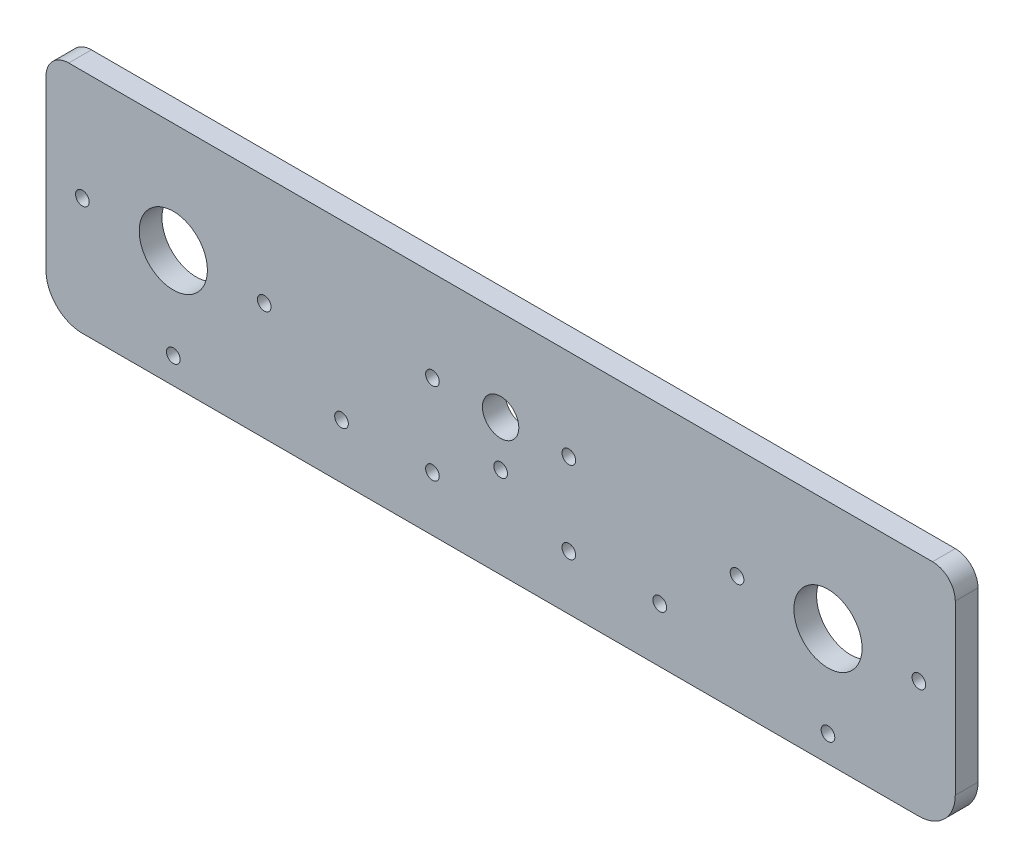
from build123d import *

# Parameters (mm, degrees)
CROQUIS1_R              = 1.5
CROQUIS1_R_2            = 7.5
CROQUIS1_R_3            = 4
SALIENTE_EXTRUIR1_DEPTH = 5
REDONDEO1_R             = 5


with BuildPart() as part:
    # Croquis1 → Saliente-Extruir1 (new body)
    with BuildSketch(Plane.XY):
        with BuildLine():
            Line((100, -37), (100, 0))
            Line((100, 0), (100, 5))
            Line((100, 5), (-100, 5))
            Line((-100, 5), (-100, 0))
            Line((-100, 0), (-100, -37))
            ThreePointArc((-100, -37), (-97.656854249, -42.656854249), (-92, -45))
            Line((-92, -45), (92, -45))
            ThreePointArc((92, -45), (97.656854249, -42.656854249), (100, -37))
        make_face()
        with Locations((-72, -39.25)):
            Circle(CROQUIS1_R, mode=Mode.SUBTRACT)
        with Locations((-35, -33)):
            Circle(CROQUIS1_R, mode=Mode.SUBTRACT)
        with Locations((-15, -33)):
            Circle(CROQUIS1_R, mode=Mode.SUBTRACT)
        with Locations((15, -33)):
            Circle(CROQUIS1_R, mode=Mode.SUBTRACT)
        with Locations((35, -33)):
            Circle(CROQUIS1_R, mode=Mode.SUBTRACT)
        with Locations((72, -39.25)):
            Circle(CROQUIS1_R, mode=Mode.SUBTRACT)
        with Locations((0, -25)):
            Circle(CROQUIS1_R, mode=Mode.SUBTRACT)
        with Locations((-92, -19.25)):
            Circle(CROQUIS1_R, mode=Mode.SUBTRACT)
        with Locations((-72, -19.25)):
            Circle(CROQUIS1_R_2, mode=Mode.SUBTRACT)
        with Locations((-52, -19.25)):
            Circle(CROQUIS1_R, mode=Mode.SUBTRACT)
        with Locations((-15, -15)):
            Circle(CROQUIS1_R, mode=Mode.SUBTRACT)
        with Locations((0, -15)):
            Circle(CROQUIS1_R_3, mode=Mode.SUBTRACT)
        with Locations((15, -15)):
            Circle(CROQUIS1_R, mode=Mode.SUBTRACT)
        with Locations((52, -19.25)):
            Circle(CROQUIS1_R, mode=Mode.SUBTRACT)
        with Locations((72, -19.25)):
            Circle(CROQUIS1_R_2, mode=Mode.SUBTRACT)
        with Locations((92, -19.25)):
            Circle(CROQUIS1_R, mode=Mode.SUBTRACT)
    extrude(amount=SALIENTE_EXTRUIR1_DEPTH)

    # Redondeo1
    redondeo1_edges = [part.edges().sort_by_distance(p)[0] for p in [
        (100, 5, 2.5),
        (-100, 5, 2.5),
    ]]
    fillet(redondeo1_edges, radius=REDONDEO1_R)


solid = part.part
